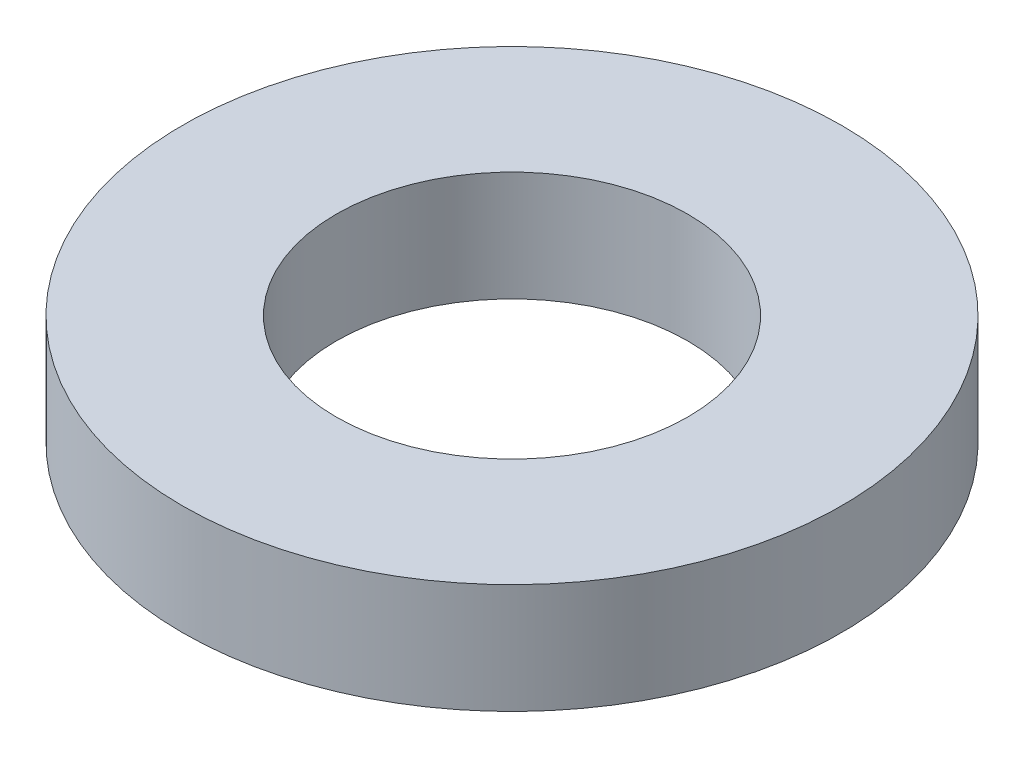
from build123d import *

# Parameters (mm, degrees)
SKETCH1_R           = 4.7625
SKETCH1_R_2         = 2.54
BOSS_EXTRUDE1_DEPTH = 1.5875


with BuildPart() as part:
    # Sketch1 → Boss-Extrude1 (new body)
    with BuildSketch(Plane(origin=(0, 0, 0), x_dir=(1, 0, 0), z_dir=(0, 1, 0))):
        Circle(SKETCH1_R)
        Circle(SKETCH1_R_2, mode=Mode.SUBTRACT)
    extrude(amount=BOSS_EXTRUDE1_DEPTH)


solid = part.part
